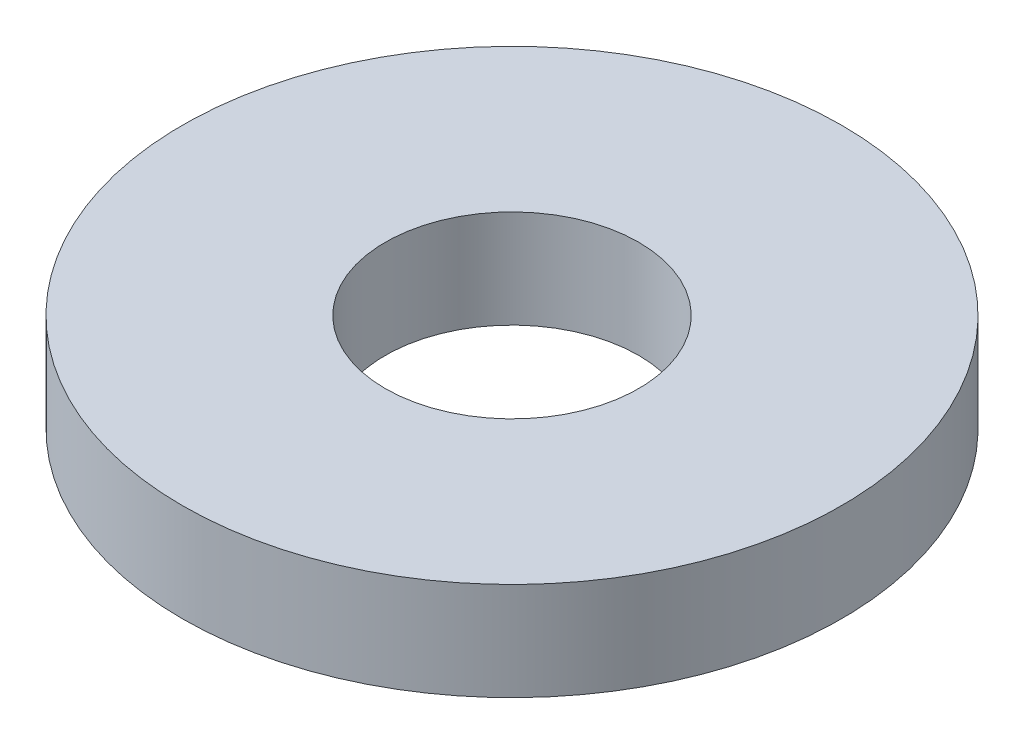
from build123d import *

# Parameters (mm, degrees)
SKETCH1_R           = 97.5
BOSS_EXTRUDE1_DEPTH = 29
SKETCH2_R           = 37.5
CUT_EXTRUDE1_DEPTH  = 141.902448524


with BuildPart() as part:
    # Sketch1 → Boss-Extrude1 (new body)
    with BuildSketch(Plane(origin=(0, 0, 0), x_dir=(1, 0, 0), z_dir=(0, 1, 0))):
        Circle(SKETCH1_R)
    extrude(amount=BOSS_EXTRUDE1_DEPTH)

    # Sketch2 → Cut-Extrude1 (cut, through all)
    with BuildSketch(Plane(origin=(0, 0, 0), x_dir=(1, 0, 0), z_dir=(0, 1, 0))):
        Circle(SKETCH2_R)
    extrude(amount=CUT_EXTRUDE1_DEPTH, mode=Mode.SUBTRACT)


solid = part.part
